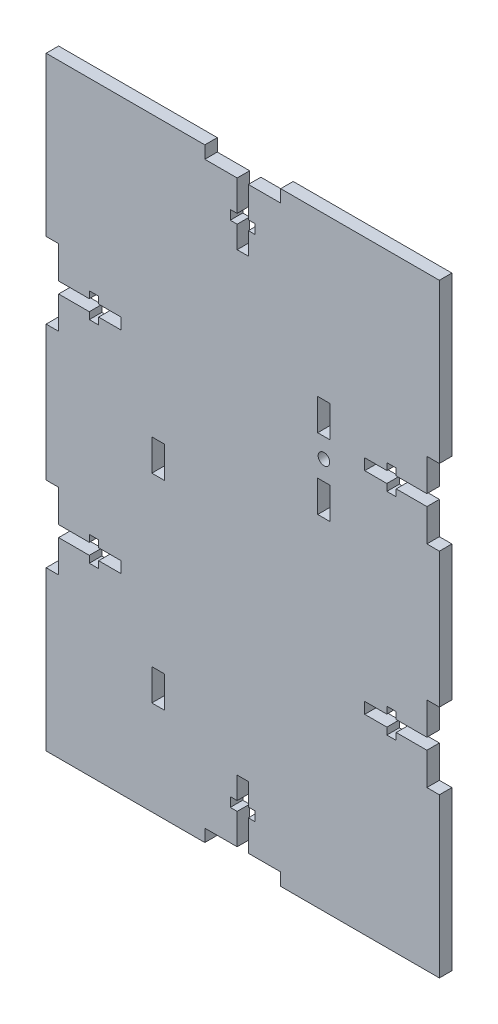
from build123d import *

# Parameters (mm, degrees)
BOSS_EXTRUDE1_DEPTH = 3.18
CUT_EXTRUDE9_DEPTH  = 92.718008183
CUT_EXTRUDE10_DEPTH = 92.718008183
SKETCH32_4_W        = 3.18
SKETCH32_4_H        = 8
SKETCH32_4_R        = 1.47
CUT_EXTRUDE18_DEPTH = 92.718008183
SKETCH33_W          = 3.18
SKETCH33_H          = 8
CUT_EXTRUDE22_DEPTH = 92.718008183


with BuildPart() as part:
    # Sketch1 → Boss-Extrude1 (new body)
    with BuildSketch(Plane.XY):
        Polygon((-50, 76.825), (-16.666666667, 76.825), (16.666666667, 76.825), (50, 76.825), (50, -76.825), (-50, -76.825), align=None)
    extrude(amount=BOSS_EXTRUDE1_DEPTH)

    # Sketch20 → Cut-Extrude9 (cut, through all)
    with BuildSketch(Plane.XY.offset(3.18)):
        Polygon((-9.65, 76.825), (9.65, 76.825), (9.65, 73.645), (1.425, 73.645), (1.425, 65.845), (3.175, 65.845), (3.175, 63.465), (1.425, 63.465), (1.425, 57.845), (-1.425, 57.845), (-1.425, 63.465), (-3.175, 63.465), (-3.175, 65.845), (-1.425, 65.845), (-1.425, 73.645), (-9.65, 73.645), align=None)
    cut_extrude9 = extrude(amount=-CUT_EXTRUDE9_DEPTH, mode=Mode.SUBTRACT)

    # Mirror3: Cut-Extrude9 across plane
    add(cut_extrude9.mirror(Plane.ZX), mode=Mode.SUBTRACT)

    # Sketch23 → Cut-Extrude10 (cut, through all)
    with BuildSketch(Plane.XY.offset(3.18)):
        Polygon((-50, 17.175), (-50, 36.475), (-46.82, 36.475), (-46.82, 28.25), (-39.02, 28.25), (-39.02, 30), (-36.64, 30), (-36.64, 28.25), (-31.02, 28.25), (-31.02, 25.4), (-36.64, 25.4), (-36.64, 23.65), (-39.02, 23.65), (-39.02, 25.4), (-46.82, 25.4), (-46.82, 17.175), align=None)
        Polygon((-50, -36.475), (-50, -17.175), (-46.82, -17.175), (-46.82, -25.4), (-39.02, -25.4), (-39.02, -23.65), (-36.64, -23.65), (-36.64, -25.4), (-31.02, -25.4), (-31.02, -28.25), (-36.64, -28.25), (-36.64, -30), (-39.02, -30), (-39.02, -28.25), (-46.82, -28.25), (-46.82, -36.475), align=None)
    cut_extrude10 = extrude(amount=-CUT_EXTRUDE10_DEPTH, mode=Mode.SUBTRACT)

    # Mirror4: Cut-Extrude10 across plane
    add(cut_extrude10.mirror(Plane(origin=(0, 0, 0), x_dir=(0, 0, 1), z_dir=(1, 0, 0))), mode=Mode.SUBTRACT)

    # Sketch32<4> → Cut-Extrude18 (cut, through all)
    with BuildSketch(Plane.XY.offset(3.18)):
        with Locations((20.65, 13.782937163)):
            Rectangle(SKETCH32_4_W, SKETCH32_4_H)
        with Locations((20.65, 31.782937163)):
            Rectangle(SKETCH32_4_W, SKETCH32_4_H)
        with Locations((20.65, 22.782937163)):
            Circle(SKETCH32_4_R)
    extrude(amount=-CUT_EXTRUDE18_DEPTH, mode=Mode.SUBTRACT)

    # Sketch33 → Cut-Extrude22 (cut, through all)
    with BuildSketch(Plane.XY):
        with Locations((-21.530032845, -48.811577341)):
            Rectangle(SKETCH33_W, SKETCH33_H)
        with Locations((-21.530032845, 1.788422659)):
            Rectangle(SKETCH33_W, SKETCH33_H)
    extrude(amount=CUT_EXTRUDE22_DEPTH, mode=Mode.SUBTRACT)


solid = part.part
